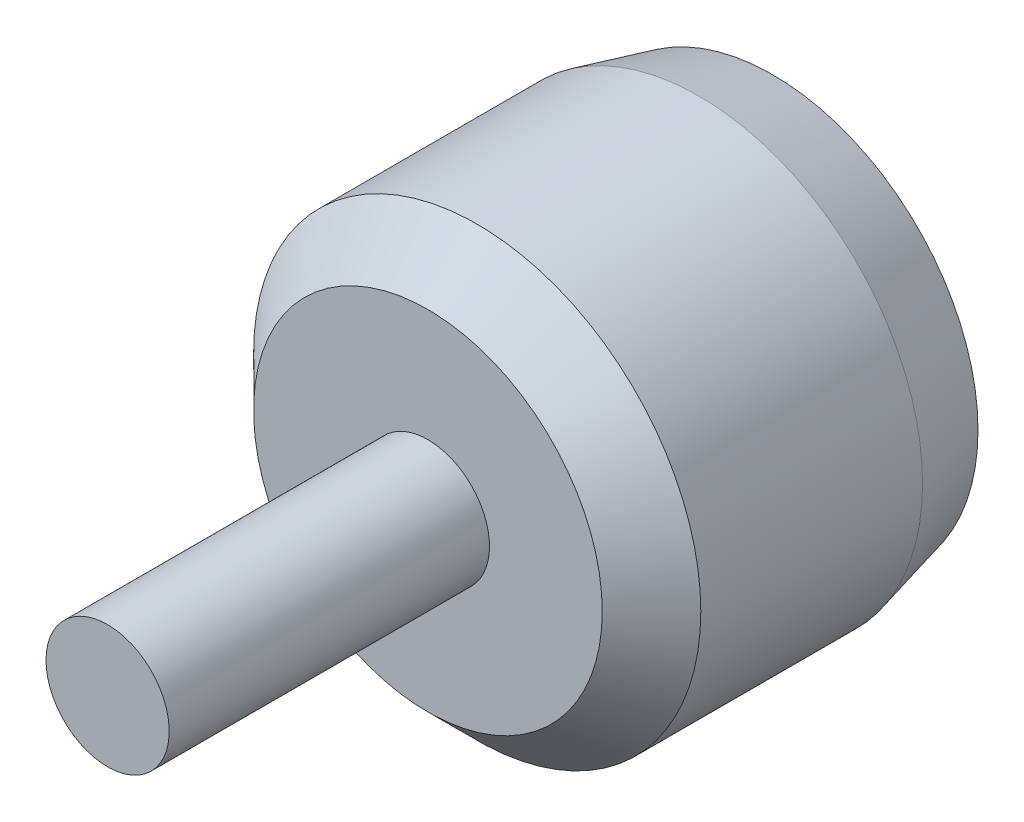
from build123d import *

# Parameters (mm, degrees)
SKETCH2_R           = 9.075
BOSS_EXTRUDE1_DEPTH = 14
CHAMFER1_SIZE       = 2
CHAMFER2_SIZE       = 0.75
CHAMFER2_SIZE2      = 3
SKETCH5_R           = 2.5
BOSS_EXTRUDE2_DEPTH = 13
SKETCH6_R           = 1
CUT_EXTRUDE1_DEPTH  = 2


with BuildPart() as part:
    # Sketch2 → Boss-Extrude1 (new body)
    with BuildSketch(Plane.XY):
        Circle(SKETCH2_R)
    extrude(amount=BOSS_EXTRUDE1_DEPTH)

    # Chamfer1
    chamfer1_edges = [part.edges().sort_by_distance(p)[0] for p in [
        (-9.075, 0, 14),
    ]]
    chamfer(chamfer1_edges, length=CHAMFER1_SIZE)

    # Chamfer2
    chamfer2_edges = [part.edges().sort_by_distance(p)[0] for p in [
        (-9.075, 0, 0),
    ]]
    chamfer2_side = [part.faces().sort_by_distance(p)[0] for p in [
        (0, 0, 0),
    ]]
    chamfer(chamfer2_edges, length=CHAMFER2_SIZE, length2=CHAMFER2_SIZE2, reference=chamfer2_side[0])

    # Sketch5 → Boss-Extrude2 (add)
    with BuildSketch(Plane.XY.offset(14)):
        Circle(SKETCH5_R)
    extrude(amount=BOSS_EXTRUDE2_DEPTH)

    # Sketch6 → Cut-Extrude1 (cut)
    with BuildSketch(Plane(origin=(0, 0, 0), x_dir=(-1, 0, 0), z_dir=(0, 0, -1))):
        with Locations((0, 6)):
            Circle(SKETCH6_R)
        with Locations((6, 0)):
            Circle(SKETCH6_R)
        with Locations((0, -6)):
            Circle(SKETCH6_R)
        with Locations((-6, 0)):
            Circle(SKETCH6_R)
    extrude(amount=-CUT_EXTRUDE1_DEPTH, mode=Mode.SUBTRACT)


solid = part.part
